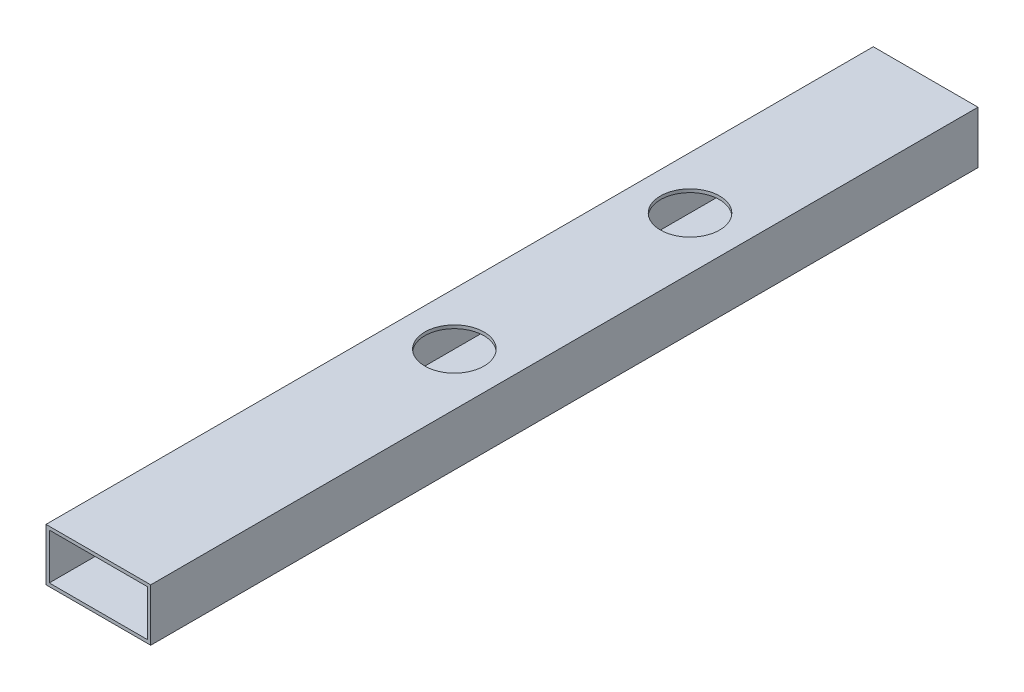
from build123d import *

# Parameters (mm, degrees)
SKETCH1_W           = 50.8
SKETCH1_H           = 25.4
SKETCH1_W_2         = 47.625
SKETCH1_H_2         = 22.225
BOSS_EXTRUDE1_DEPTH = 401.32
SKETCH2_R           = 14.351
CUT_EXTRUDE1_DEPTH  = 406.319062468


with BuildPart() as part:
    # Sketch1 → Boss-Extrude1 (new body)
    with BuildSketch(Plane.XY):
        with Locations((25.4, 12.7)):
            Rectangle(SKETCH1_W, SKETCH1_H)
        with Locations((25.4, 12.7)):
            Rectangle(SKETCH1_W_2, SKETCH1_H_2, mode=Mode.SUBTRACT)
    extrude(amount=BOSS_EXTRUDE1_DEPTH)

    # Sketch2 → Cut-Extrude1 (cut, through all)
    with BuildSketch(Plane(origin=(0, 25.4, 0), x_dir=(1, 0, 0), z_dir=(0, 1, 0))):
        with Locations((25.4, -114.3)):
            Circle(SKETCH2_R)
        with Locations((25.4, -228.6)):
            Circle(SKETCH2_R)
    extrude(amount=-CUT_EXTRUDE1_DEPTH, mode=Mode.SUBTRACT)


solid = part.part
